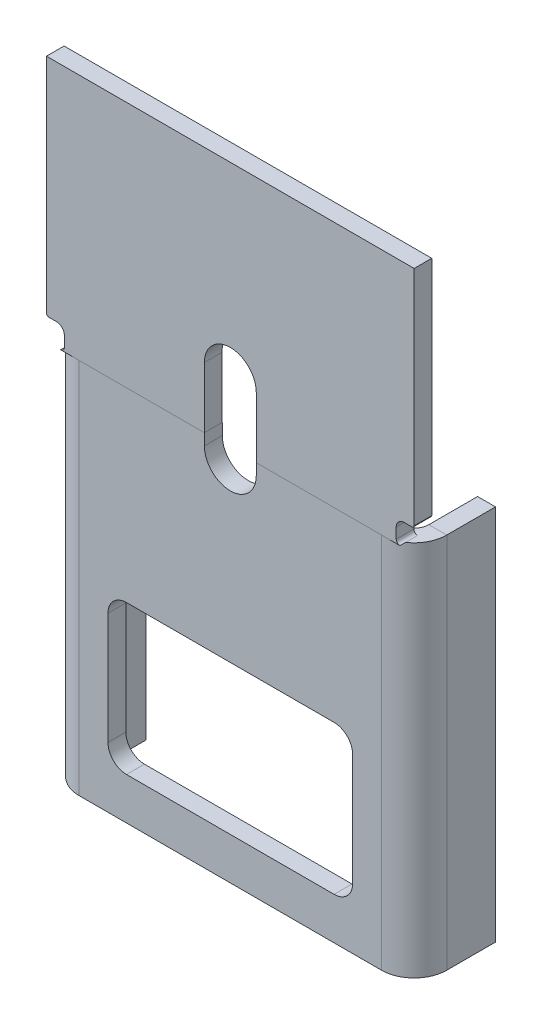
from build123d import *

# Parameters (mm, degrees)
BOSS_EXTRUDE1_DEPTH    = 61
BOSS_EXTRUDE2_DEPTH    = 40
CONVERT_SOLID2_DEPTH   = 61
CONVERT_SOLID2_2_DEPTH = 61
CUT_EXTRUDE3_DEPTH     = 118.676473435
SKETCH16_W             = 39.6
SKETCH16_H             = 24.1
CUT_EXTRUDE4_DEPTH     = 118.672099072
FILLET1_R              = 3
CUT_EXTRUDE5_DEPTH     = 118.960581976


# Read off the part's stored shape, not the designer's step: Convert-Solid2
with BuildPart() as part:
    # Sketch1 → Boss-Extrude1 (new body)
    with BuildSketch(Plane(origin=(0, 0, 0), x_dir=(1, 0, 0), z_dir=(0, 1, 0))):
        Polygon((0, 13.17), (0, 0), (59.5, 0), (59.5, 13.17), (56.65, 13.17), (56.65, 2.85), (2.85, 2.85), (2.85, 13.17), align=None)
    extrude(amount=BOSS_EXTRUDE1_DEPTH)

    # Convert-Solid2 outline → Convert-Solid2 (cut)
    with BuildSketch(Plane(origin=(0, 0, 0), x_dir=(1, 0, 0), z_dir=(0, 1, 0))):
        with BuildLine():
            Line((0, 0), (5.280000066, 0))
            ThreePointArc((5.280000066, 0), (1.546476215, 1.546476215), (0, 5.280000066))
            Line((0, 5.280000066), (0, 0))
        make_face()
        with BuildLine():
            Line((54.219999934, 0), (59.5, 0))
            Line((59.5, 0), (59.5, 5.280000066))
            ThreePointArc((59.5, 5.280000066), (57.953523785, 1.546476215), (54.219999934, 0))
        make_face()
    extrude(amount=CONVERT_SOLID2_DEPTH, mode=Mode.SUBTRACT)

    # Convert-Solid2 2 outline → Convert-Solid2 2 (add)
    with BuildSketch(Plane(origin=(0, 0, 0), x_dir=(1, 0, 0), z_dir=(0, 1, 0))):
        with BuildLine():
            Line((2.85, 13.17), (2.85, 2.85))
            Line((2.85, 2.85), (56.65, 2.85))
            Line((56.65, 2.85), (56.65, 13.17))
            Line((56.65, 13.17), (56.6, 13.17))
            Line((56.6, 13.17), (56.6, 5.280000066))
            ThreePointArc((56.6, 5.280000066), (55.90291412, 3.59708588), (54.219999934, 2.9))
            Line((54.219999934, 2.9), (5.280000066, 2.9))
            ThreePointArc((5.280000066, 2.9), (3.59708588, 3.59708588), (2.9, 5.280000066))
            Line((2.9, 5.280000066), (2.9, 13.17))
            Line((2.9, 13.17), (2.85, 13.17))
        make_face()
    extrude(amount=CONVERT_SOLID2_2_DEPTH)

    # Sketch16 → Cut-Extrude4 (cut, through all)
    with BuildSketch(Plane(origin=(0, 0, -2.9), x_dir=(-1, 0, 0), z_dir=(0, 0, -1))):
        with Locations((-29.75, 18.85)):
            Rectangle(SKETCH16_W, SKETCH16_H)
    extrude(amount=-CUT_EXTRUDE4_DEPTH, mode=Mode.SUBTRACT)

    # Fillet1
    fillet1_edges = [part.edges().sort_by_distance(p)[0] for p in [
        (9.95, 30.9, -1.45),
        (9.95, 6.8, -1.45),
        (49.55, 6.8, -1.45),
        (49.55, 30.9, -1.45),
    ]]
    fillet(fillet1_edges, radius=FILLET1_R)


with BuildPart() as body_2:
    # Sketch9 → Boss-Extrude2 (new body)
    with BuildSketch(Plane(origin=(0, 61, 0), x_dir=(1, 0, 0), z_dir=(0, 1, 0))):
        Polygon((2.85, 2.85), (0, 2.85), (0, 0), (59.5, 0), (59.5, 2.85), align=None)
    extrude(amount=BOSS_EXTRUDE2_DEPTH)

    # Sketch14 → Cut-Extrude3 (cut, through all)
    with BuildSketch(Plane(origin=(0, 0, -2.85), x_dir=(-1, 0, 0), z_dir=(0, 0, -1))):
        with BuildLine():
            Line((-59.5, 61), (-57.204121235, 61))
            ThreePointArc((-57.204121235, 61), (-56.776943013, 61.176943013), (-56.6, 61.604121235))
            Line((-56.6, 61.604121235), (-56.6, 63.292565633))
            ThreePointArc((-56.6, 63.292565633), (-56.98293866, 64.21706134), (-57.907434367, 64.6))
            Line((-57.907434367, 64.6), (-59.082936249, 64.6))
            ThreePointArc((-59.082936249, 64.6), (-59.352003791, 64.695793289), (-59.5, 64.940069401))
            Line((-59.5, 64.940069401), (-59.938547492, 64.940069401))
            Line((-59.938547492, 64.940069401), (-59.938547492, 64.6))
            Line((-59.938547492, 64.6), (-59.938547492, 61))
            Line((-59.938547492, 61), (-59.5, 61))
        make_face()
        with BuildLine():
            Line((0, 64.940069401), (0.438547492, 64.940069401))
            Line((0.438547492, 64.940069401), (0.438547492, 64.6))
            Line((0.438547492, 64.6), (0.438547492, 61))
            Line((0.438547492, 61), (0, 61))
            Line((0, 61), (-2.295878765, 61))
            ThreePointArc((-2.295878765, 61), (-2.723056987, 61.176943013), (-2.9, 61.604121235))
            Line((-2.9, 61.604121235), (-2.9, 63.292565633))
            ThreePointArc((-2.9, 63.292565633), (-2.51706134, 64.21706134), (-1.592565633, 64.6))
            Line((-1.592565633, 64.6), (-0.417063751, 64.6))
            ThreePointArc((-0.417063751, 64.6), (-0.147996209, 64.695793289), (0, 64.940069401))
        make_face()
    extrude(amount=-CUT_EXTRUDE3_DEPTH, mode=Mode.SUBTRACT)


with BuildPart() as cut_extrude5_tool:
    # Sketch17 → Cut-Extrude5 (new, through all)
    with BuildSketch(Plane.XY):
        with BuildLine():
            Line((25.55, 59.15), (25.55, 70.85))
            ThreePointArc((25.55, 70.85), (29.75, 75.05), (33.95, 70.85))
            Line((33.95, 70.85), (33.95, 59.15))
            ThreePointArc((33.95, 59.15), (29.75, 54.95), (25.55, 59.15))
        make_face()
    extrude(amount=-CUT_EXTRUDE5_DEPTH)


with BuildPart() as part_1:
    add(part.part)

    # Cut-Extrude5: cut by cut_extrude5_tool
    add(cut_extrude5_tool.part, mode=Mode.SUBTRACT)


with BuildPart() as body_2_1:
    add(body_2.part)

    # Cut-Extrude5: cut by cut_extrude5_tool
    add(cut_extrude5_tool.part, mode=Mode.SUBTRACT)


solid = Compound([part_1.part, body_2_1.part])
